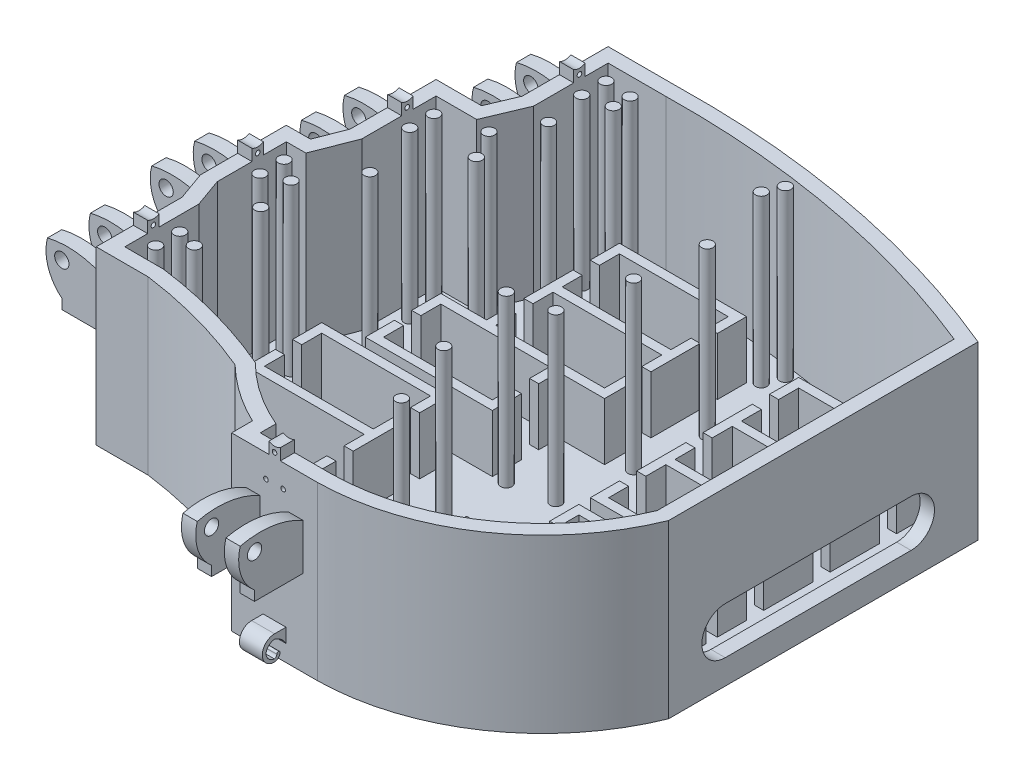
from build123d import *

# Parameters (mm, degrees)
BOSS_EXTRUDE1_DEPTH                = 38.1
CUT_EXTRUDE1_DEPTH                 = 36.83
SERVO_BOX_1_DEPTH                  = 13.97
SERVO_BOX_2_DEPTH                  = 13.97
SERVO_BOX_3_DEPTH                  = 13.97
SERVO_BOX_4_DEPTH                  = 13.97
SERVO_BOX_5_DEPTH                  = 13.97
SERVO_BOX_6_DEPTH                  = 13.97
SERVO_BOX_7_DEPTH                  = 13.97
SERVO_BOX_8_DEPTH                  = 13.97
SERVO_BOX_9_DEPTH                  = 13.97
SERVO_BOX_10_DEPTH                 = 13.97
SKETCH25_R                         = 0.508
THUMB_HOLES_DEPTH                  = 12.7
SKETCH31_R                         = 0.508
INDEX_FINGER_HOLES_DEPTH           = 17.018
SKETCH32_R                         = 0.508
MIDDLE_FINGER_HOLES_DEPTH          = 15.24
SKETCH33_R                         = 0.508
RING_FINGER_HOLES_DEPTH            = 22.86
SKETCH34_R                         = 0.508
PINKY_FINGER_HOLES_DEPTH           = 35.56
SKETCH26_R                         = 1.27
GUIDE_POLES_DEPTH                  = 36.83
SKETCH35_R                         = 1.5875
PINKY_ATTACHMENT_DEPTH             = 19.05
SKETCH36_R                         = 1.5875
RING_ATTACHMENT_DEPTH              = 19.05
SKETCH37_R                         = 1.5875
MIDDLE_ATTACHMENT_DEPTH            = 19.05
SKETCH38_R                         = 1.5875
POINTER_ATTACHMENT_DEPTH           = 19.05
SKETCH39_R                         = 1.5875
THUMB_ATTACHMENT_DEPTH             = 19.05
ATTACHMENT_TRIM_DEPTH              = 25.4
CORD_HOLE_DEPTH                    = 5.08
SKETCH42_W                         = 3.175
SKETCH42_H                         = 2.54
SKETCH42_W_2                       = 2.54
SKETCH42_H_2                       = 3.175
LINE_CONNECTORS_ON_HAND_EDGE_DEPTH = 2.54
SKETCH43_R                         = 0.508
FINGER_LINE_CONNECTOR_CUT_DEPTH    = 50.8
SKETCH44_R                         = 0.508
THUMB_LINE_CONNECTOR_CUT_DEPTH     = 12.7
PINKY_HOOK_DEPTH                   = 19.05
SKETCH47_W                         = 5.527423295
SKETCH47_H                         = 7.099733724
PINKY_HOOK_CUT_1_DEPTH             = 19.05
RING_HOOK_DEPTH                    = 19.05
SKETCH53_W                         = 5.632789883
SKETCH53_H                         = 7.123488913
RING_HOOK_CUT_1_DEPTH              = 19.05
MIDDLE_HOOK_DEPTH                  = 19.05
MIDDLE_HOOK_2_DEPTH                = 19.05
SKETCH57_W                         = 6.44385504
SKETCH57_H                         = 7.30367128
MIDDLE_HOOK_CUT_1_DEPTH            = 19.05
POINTER_HOOK_DEPTH                 = 19.05
SKETCH60_W                         = 5.76253221
SKETCH60_H                         = 6.997945427
POINTER_HOOK_CUT_1_DEPTH           = 19.05
THUMB_HOOK_DEPTH                   = 19.05
SKETCH64_W                         = 5.967890502
SKETCH64_H                         = 7.075125102
THUMB_HOOK_CUT_1_DEPTH             = 19.05
SKETCH65_W                         = 7.179265415
SKETCH65_H                         = 6.121930472
SKETCH65_W_2                       = 6.985
SKETCH65_H_2                       = 5.903479726
SKETCH65_W_3                       = 5.256802475
SKETCH65_H_3                       = 6.985
SKETCH65_W_4                       = 5.256802476
SKETCH65_W_5                       = 5.561170092
CUT_EXTRUDE9_DEPTH                 = 13.97


with BuildPart() as part:
    # Sketch2 → Boss-Extrude1 (new body)
    with BuildSketch(Plane(origin=(0, 0, 0), x_dir=(1, 0, 0), z_dir=(0, 1, 0))):
        with BuildLine():
            Line((-20.778406205, 52.758673202), (-36.188953289, 52.758673202))
            Line((-36.188953289, 52.758673202), (-36.188953289, 33.708673202))
            Line((-36.188953289, 33.708673202), (-38.864171838, 27.358673202))
            Line((-38.864171838, 27.358673202), (-48.947687906, 27.358673202))
            Line((-48.947687906, 27.358673202), (-48.947687906, 8.308673202))
            Line((-48.947687906, 8.308673202), (-51.417120413, 1.958673202))
            Line((-51.417120413, 1.958673202), (-56.767557511, 1.958673202))
            Line((-56.767557511, 1.958673202), (-56.767557511, -17.091326798))
            Line((-56.767557511, -17.091326798), (-54.503911047, -23.441326798))
            Line((-54.503911047, -23.441326798), (-54.503911047, -42.491326798))
            Line((-54.503911047, -42.491326798), (-42.959403849, -42.491326798))
            ThreePointArc((-42.959403849, -42.491326798), (-29.448791922, -45.239401215), (-16.422067996, -49.755263412))
            ThreePointArc((-16.422067996, -49.755263412), (-10.441569813, -54.6928899), (-3.738179712, -58.593027718))
            Line((-3.738179712, -58.593027718), (-3.738179712, -63.210333869))
            Line((-3.738179712, -63.210333869), (15.311820288, -63.210333869))
            ThreePointArc((15.311820288, -63.210333869), (43.202331698, -54.363191859), (61.572422141, -31.588374066))
            Line((61.572422141, -31.588374066), (61.572422141, 37.055318004))
            ThreePointArc((61.572422141, 37.055318004), (21.220515188, 49.225595088), (-20.778406205, 52.758673202))
        make_face()
    extrude(amount=BOSS_EXTRUDE1_DEPTH)

    # Sketch3 → Cut-Extrude1 (cut)
    with BuildSketch(Plane(origin=(0, 38.1, 0), x_dir=(1, 0, 0), z_dir=(0, 1, 0))):
        with BuildLine():
            Line((-20.159319953, 49.594969273), (-33.013953289, 49.594969273))
            Line((-33.013953289, 49.594969273), (-33.013953289, 33.06717139))
            Line((-33.013953289, 33.06717139), (-36.756520081, 24.183673202))
            Line((-36.756520081, 24.183673202), (-45.772687906, 24.183673202))
            Line((-45.772687906, 24.183673202), (-45.772687906, 7.713042295))
            Line((-45.772687906, 7.713042295), (-49.245203545, -1.216326798))
            Line((-49.245203545, -1.216326798), (-53.592557511, -1.216326798))
            Line((-53.592557511, -1.216326798), (-53.592557511, -16.542334896))
            Line((-53.592557511, -16.542334896), (-51.328911047, -22.892334896))
            Line((-51.328911047, -22.892334896), (-51.328911047, -39.316326798))
            Line((-51.328911047, -39.316326798), (-42.747740567, -39.316326798))
            ThreePointArc((-42.747740567, -39.316326798), (-28.419200466, -42.229621341), (-14.622308527, -47.071121038))
            ThreePointArc((-14.622308527, -47.071121038), (-8.048983539, -52.483535855), (-0.563179712, -56.541315619))
            Line((-0.563179712, -56.541315619), (-0.563179712, -60.035333869))
            Line((-0.563179712, -60.035333869), (15.331165443, -60.035333869))
            ThreePointArc((15.331165443, -60.035333869), (41.184823367, -51.896260365), (58.397422141, -30.958672418))
            Line((58.397422141, -30.958672418), (58.397422141, 34.932598454))
            ThreePointArc((58.397422141, 34.932598454), (19.863190978, 46.250670136), (-20.159319953, 49.594969273))
        make_face()
    extrude(amount=-CUT_EXTRUDE1_DEPTH, mode=Mode.SUBTRACT)

    # Sketch6 → Servo Box 1 (add)
    with BuildSketch(Plane(origin=(0, 0, 0), x_dir=(1, 0, 0), z_dir=(0, 1, 0))):
        Polygon((-39.057888343, -32.914501669), (-37.025888343, -32.914501669), (-37.025888343, -37.359501669), (-12.895888343, -37.359501669), (-12.895888343, -32.914501669), (-10.863888343, -32.914501669), (-10.863888343, -39.391501669), (-39.057888343, -39.391501669), align=None)
        Polygon((-12.895888343, -24.659501669), (-37.025888343, -24.659501669), (-37.025888343, -29.104501669), (-39.057888343, -29.104501669), (-39.057888343, -22.627501669), (-10.863888343, -22.627501669), (-10.863888343, -29.104501669), (-12.895888343, -29.104501669), align=None)
    extrude(amount=SERVO_BOX_1_DEPTH)

    # Sketch7 → Servo Box 2 (add)
    with BuildSketch(Plane(origin=(0, 0, 0), x_dir=(1, 0, 0), z_dir=(0, 1, 0))):
        Polygon((-39.057888343, -18.182501669), (-37.025888343, -18.182501669), (-37.025888343, -22.627501669), (-12.895888343, -22.627501669), (-12.895888343, -18.182501669), (-10.863888343, -18.182501669), (-10.863888343, -24.659501669), (-39.057888343, -24.659501669), align=None)
        Polygon((-12.895888343, -9.927501669), (-37.025888343, -9.927501669), (-37.025888343, -14.372501669), (-39.057888343, -14.372501669), (-39.057888343, -7.895501669), (-10.863888343, -7.895501669), (-10.863888343, -14.372501669), (-12.895888343, -14.372501669), align=None)
    extrude(amount=SERVO_BOX_2_DEPTH)

    # Sketch15 → Servo Box 3 (add)
    with BuildSketch(Plane.XZ):
        Polygon((-31.437888343, -4.423498331), (-29.405888343, -4.423498331), (-29.405888343, -8.868498331), (-5.275888343, -8.868498331), (-5.275888343, -4.423498331), (-3.243888343, -4.423498331), (-3.243888343, -10.900498331), (-31.437888343, -10.900498331), align=None)
        Polygon((-5.275888343, 3.831501669), (-29.405888343, 3.831501669), (-29.405888343, -0.613498331), (-31.437888343, -0.613498331), (-31.437888343, 5.863501669), (-3.243888343, 5.863501669), (-3.243888343, -0.613498331), (-5.275888343, -0.613498331), align=None)
    extrude(amount=-SERVO_BOX_3_DEPTH)

    # Sketch16 → Servo Box 4 (add)
    with BuildSketch(Plane.XZ):
        Polygon((-21.277888343, -19.155498331), (-19.245888343, -19.155498331), (-19.245888343, -23.600498331), (4.884111657, -23.600498331), (4.884111657, -19.155498331), (6.916111657, -19.155498331), (6.916111657, -25.632498331), (-21.277888343, -25.632498331), align=None)
        Polygon((4.884111657, -10.900498331), (-19.245888343, -10.900498331), (-19.245888343, -15.345498331), (-21.277888343, -15.345498331), (-21.277888343, -8.868498331), (6.916111657, -8.868498331), (6.916111657, -15.345498331), (4.884111657, -15.345498331), align=None)
    extrude(amount=-SERVO_BOX_4_DEPTH)

    # Sketch17 → Servo Box 5 (add)
    with BuildSketch(Plane.XZ):
        Polygon((-21.277888343, -33.887498331), (-19.245888343, -33.887498331), (-19.245888343, -38.332498331), (4.884111657, -38.332498331), (4.884111657, -33.887498331), (6.916111657, -33.887498331), (6.916111657, -40.364498331), (-21.277888343, -40.364498331), align=None)
        Polygon((4.884111657, -25.632498331), (-19.245888343, -25.632498331), (-19.245888343, -30.077498331), (-21.277888343, -30.077498331), (-21.277888343, -23.600498331), (6.916111657, -23.600498331), (6.916111657, -30.077498331), (4.884111657, -30.077498331), align=None)
    extrude(amount=-SERVO_BOX_5_DEPTH)

    # Sketch18 → Servo Box 6 (add)
    with BuildSketch(Plane.XZ):
        Polygon((14.218982224, 35.510467966), (16.250982224, 35.510467966), (16.250982224, 31.065467966), (40.380982224, 31.065467966), (40.380982224, 35.510467966), (42.412982224, 35.510467966), (42.412982224, 29.033467966), (14.218982224, 29.033467966), align=None)
        Polygon((40.380982224, 43.765467966), (16.250982224, 43.765467966), (16.250982224, 39.320467966), (14.218982224, 39.320467966), (14.218982224, 45.797467966), (42.412982224, 45.797467966), (42.412982224, 39.320467966), (40.380982224, 39.320467966), align=None)
    extrude(amount=-SERVO_BOX_6_DEPTH)

    # Sketch19 → Servo Box 7 (add)
    with BuildSketch(Plane.XZ):
        Polygon((24.378982224, 20.778467966), (26.410982224, 20.778467966), (26.410982224, 16.333467966), (50.540982224, 16.333467966), (50.540982224, 20.778467966), (52.572982224, 20.778467966), (52.572982224, 14.301467966), (24.378982224, 14.301467966), align=None)
        Polygon((50.540982224, 29.033467966), (26.410982224, 29.033467966), (26.410982224, 24.588467966), (24.378982224, 24.588467966), (24.378982224, 31.065467966), (52.572982224, 31.065467966), (52.572982224, 24.588467966), (50.540982224, 24.588467966), align=None)
    extrude(amount=-SERVO_BOX_7_DEPTH)

    # Sketch20 → Servo Box 8 (add)
    with BuildSketch(Plane.XZ):
        Polygon((24.378982224, 1.474467966), (26.410982224, 1.474467966), (26.410982224, -2.970532034), (50.540982224, -2.970532034), (50.540982224, 1.474467966), (52.572982224, 1.474467966), (52.572982224, -5.002532034), (24.378982224, -5.002532034), align=None)
        Polygon((50.540982224, 9.729467966), (26.410982224, 9.729467966), (26.410982224, 5.284467966), (24.378982224, 5.284467966), (24.378982224, 11.761467966), (52.572982224, 11.761467966), (52.572982224, 5.284467966), (50.540982224, 5.284467966), align=None)
    extrude(amount=-SERVO_BOX_8_DEPTH)

    # Sketch21 → Servo Box 9 (add)
    with BuildSketch(Plane.XZ):
        Polygon((24.378982224, -13.257532034), (26.410982224, -13.257532034), (26.410982224, -17.702532034), (50.540982224, -17.702532034), (50.540982224, -13.257532034), (52.572982224, -13.257532034), (52.572982224, -19.734532034), (24.378982224, -19.734532034), align=None)
        Polygon((50.540982224, -5.002532034), (26.410982224, -5.002532034), (26.410982224, -9.447532034), (24.378982224, -9.447532034), (24.378982224, -2.970532034), (52.572982224, -2.970532034), (52.572982224, -9.447532034), (50.540982224, -9.447532034), align=None)
    extrude(amount=-SERVO_BOX_9_DEPTH)

    # Sketch22 → Servo Box 10 (add)
    with BuildSketch(Plane.XZ):
        Polygon((24.378982224, -27.989532034), (26.410982224, -27.989532034), (26.410982224, -32.434532034), (50.540982224, -32.434532034), (50.540982224, -27.989532034), (52.572982224, -27.989532034), (52.572982224, -34.466532034), (24.378982224, -34.466532034), align=None)
        Polygon((50.540982224, -19.734532034), (26.410982224, -19.734532034), (26.410982224, -24.179532034), (24.378982224, -24.179532034), (24.378982224, -17.702532034), (52.572982224, -17.702532034), (52.572982224, -24.179532034), (50.540982224, -24.179532034), align=None)
    extrude(amount=-SERVO_BOX_10_DEPTH)

    # Sketch25 → Thumb Holes (cut)
    with BuildSketch(Plane.XY.offset(63.5)):
        with Locations((7.691820288, 33.02)):
            Circle(SKETCH25_R)
        with Locations((3.881820288, 33.02)):
            Circle(SKETCH25_R)
    extrude(amount=-THUMB_HOLES_DEPTH, mode=Mode.SUBTRACT)

    # Sketch31 → Index Finger Holes (cut)
    with BuildSketch(Plane(origin=(-69.85, 0, 0), x_dir=(0, 0, -1), z_dir=(1, 0, 0))):
        with Locations((-31.061326798, 33.02)):
            Circle(SKETCH31_R)
        with Locations((-34.871326798, 33.02)):
            Circle(SKETCH31_R)
    extrude(amount=INDEX_FINGER_HOLES_DEPTH, mode=Mode.SUBTRACT)

    # Sketch32 → Middle Finger Holes (cut)
    with BuildSketch(Plane(origin=(-69.85, 0, 0), x_dir=(0, 0, -1), z_dir=(1, 0, 0))):
        with Locations((-9.471326798, 33.02)):
            Circle(SKETCH32_R)
        with Locations((-5.661326798, 33.02)):
            Circle(SKETCH32_R)
    extrude(amount=MIDDLE_FINGER_HOLES_DEPTH, mode=Mode.SUBTRACT)

    # Sketch33 → Ring Finger Holes (cut)
    with BuildSketch(Plane(origin=(-69.85, 0, 0), x_dir=(0, 0, -1), z_dir=(1, 0, 0))):
        with Locations((15.928673202, 33.02)):
            Circle(SKETCH33_R)
        with Locations((19.738673202, 33.02)):
            Circle(SKETCH33_R)
    extrude(amount=RING_FINGER_HOLES_DEPTH, mode=Mode.SUBTRACT)

    # Sketch34 → Pinky Finger Holes (cut)
    with BuildSketch(Plane(origin=(-69.85, 0, 0), x_dir=(0, 0, -1), z_dir=(1, 0, 0))):
        with Locations((41.328673202, 33.02)):
            Circle(SKETCH34_R)
        with Locations((45.181435651, 33.02)):
            Circle(SKETCH34_R)
    extrude(amount=PINKY_FINGER_HOLES_DEPTH, mode=Mode.SUBTRACT)

    # Sketch26 → Guide Poles (add)
    with BuildSketch(Plane(origin=(0, 38.1, 0), x_dir=(1, 0, 0), z_dir=(0, 1, 0))):
        with Locations((8.453820288, -37.732967966)):
            Circle(SKETCH26_R)
        with Locations((3.119820288, -23.000967966)):
            Circle(SKETCH26_R)
        with Locations((8.678446045, -3.696967966)):
            Circle(SKETCH26_R)
        with Locations((11.201223007, 11.035032034)):
            Circle(SKETCH26_R)
        with Locations((12.805413161, 25.767032034)):
            Circle(SKETCH26_R)
        with Locations((-0.402046797, -5.607456419)):
            Circle(SKETCH26_R)
        with Locations((10.265413161, 45.617861539)):
            Circle(SKETCH26_R)
        with Locations((8.661223007, 41.885747394)):
            Circle(SKETCH26_R)
        with Locations((-45.613911047, -8.147456419)):
            Circle(SKETCH26_R)
        with Locations((-50.417557511, -10.233326798)):
            Circle(SKETCH26_R)
        with Locations((-50.417557511, -4.899326798)):
            Circle(SKETCH26_R)
        with Locations((-43.893096038, -16.595001669)):
            Circle(SKETCH26_R)
        with Locations((-38.480256327, 2.200998331)):
            Circle(SKETCH26_R)
        with Locations((-29.603786365, 16.932998331)):
            Circle(SKETCH26_R)
        with Locations((-42.597687906, 15.166673202)):
            Circle(SKETCH26_R)
        with Locations((-28.301638115, 31.664998331)):
            Circle(SKETCH26_R)
        with Locations((-33.046983998, 23.19417141)):
            Circle(SKETCH26_R)
        with Locations((-42.597687906, 20.500673202)):
            Circle(SKETCH26_R)
        with Locations((-24.169255621, 41.885747394)):
            Circle(SKETCH26_R)
        with Locations((-24.169255621, 45.617861539)):
            Circle(SKETCH26_R)
        with Locations((-29.838953289, 40.566673202)):
            Circle(SKETCH26_R)
        with Locations((-29.838953289, 45.943435651)):
            Circle(SKETCH26_R)
        with Locations((-48.153911047, -35.633326798)):
            Circle(SKETCH26_R)
        with Locations((-48.153911047, -30.299326798)):
            Circle(SKETCH26_R)
        with Locations((-43.893096038, -31.327001669)):
            Circle(SKETCH26_R)
    extrude(amount=-GUIDE_POLES_DEPTH)

    # Sketch35 → Pinky Attachment (add)
    with BuildSketch(Plane(origin=(0, 0, -52.758673202), x_dir=(-1, 0, 0), z_dir=(0, 0, -1))):
        with BuildLine():
            Line((36.188953289, 19.05), (40.633953289, 19.05))
            Line((40.633953289, 19.05), (46.983953289, 19.05))
            Line((46.983953289, 19.05), (46.983953289, 21.249207691))
            ThreePointArc((46.983953289, 21.249207691), (50.046648442, 25.776891551), (50.158953289, 31.242))
            ThreePointArc((50.158953289, 31.242), (42.978780551, 31.567812574), (36.188953289, 29.21))
            Line((36.188953289, 29.21), (36.188953289, 19.05))
        make_face()
        with Locations((46.983953289, 28.575)):
            Circle(SKETCH35_R, mode=Mode.SUBTRACT)
    extrude(amount=-PINKY_ATTACHMENT_DEPTH)

    # Sketch36 → Ring Attachment (add)
    with BuildSketch(Plane(origin=(0, 0, -27.358673202), x_dir=(-1, 0, 0), z_dir=(0, 0, -1))):
        with BuildLine():
            Line((48.947687906, 29.21), (48.947687906, 19.05))
            Line((48.947687906, 19.05), (53.392687906, 19.05))
            Line((53.392687906, 19.05), (59.742687906, 19.05))
            Line((59.742687906, 19.05), (59.742687906, 21.249207691))
            ThreePointArc((59.742687906, 21.249207691), (62.80538306, 25.776891551), (62.917687906, 31.242))
            ThreePointArc((62.917687906, 31.242), (55.737515168, 31.567812574), (48.947687906, 29.21))
        make_face()
        with Locations((59.742687906, 28.707395517)):
            Circle(SKETCH36_R, mode=Mode.SUBTRACT)
    extrude(amount=-RING_ATTACHMENT_DEPTH)

    # Sketch37 → Middle Attachment (add)
    with BuildSketch(Plane(origin=(0, 0, -1.958673202), x_dir=(-1, 0, 0), z_dir=(0, 0, -1))):
        with BuildLine():
            Line((56.767557511, 29.21), (56.767557511, 19.05))
            Line((56.767557511, 19.05), (61.212557511, 19.05))
            Line((61.212557511, 19.05), (67.562557511, 19.05))
            Line((67.562557511, 19.05), (67.562557511, 21.249207691))
            ThreePointArc((67.562557511, 21.249207691), (70.625252665, 25.776891551), (70.737557511, 31.242))
            ThreePointArc((70.737557511, 31.242), (63.557384773, 31.567812574), (56.767557511, 29.21))
        make_face()
        with Locations((67.562557511, 28.575)):
            Circle(SKETCH37_R, mode=Mode.SUBTRACT)
    extrude(amount=-MIDDLE_ATTACHMENT_DEPTH)

    # Sketch38 → Pointer Attachment (add)
    with BuildSketch(Plane(origin=(0, 0, 23.441326798), x_dir=(-1, 0, 0), z_dir=(0, 0, -1))):
        with BuildLine():
            Line((54.503911047, 29.21), (54.503911047, 19.05))
            Line((54.503911047, 19.05), (65.298911047, 19.05))
            Line((65.298911047, 19.05), (65.298911047, 21.249207691))
            ThreePointArc((65.298911047, 21.249207691), (68.3616062, 25.776891551), (68.473911047, 31.242))
            ThreePointArc((68.473911047, 31.242), (61.293738309, 31.567812574), (54.503911047, 29.21))
        make_face()
        with Locations((65.298911047, 28.575)):
            Circle(SKETCH38_R, mode=Mode.SUBTRACT)
    extrude(amount=-POINTER_ATTACHMENT_DEPTH)

    # Sketch39 → Thumb Attachment (add)
    with BuildSketch(Plane.ZY.offset(3.738179712)):
        with BuildLine():
            Line((63.210333869, 19.05), (67.655333869, 19.05))
            Line((67.655333869, 19.05), (74.005333869, 19.05))
            Line((74.005333869, 19.05), (74.005333869, 21.249207691))
            ThreePointArc((74.005333869, 21.249207691), (77.068029022, 25.776891551), (77.180333869, 31.242))
            ThreePointArc((77.180333869, 31.242), (70.000161131, 31.567812574), (63.210333869, 29.21))
            Line((63.210333869, 29.21), (63.210333869, 19.05))
        make_face()
        with Locations((74.005333869, 28.575)):
            Circle(SKETCH39_R, mode=Mode.SUBTRACT)
    extrude(amount=-THUMB_ATTACHMENT_DEPTH)

    # Sketch40 → Attachment Trim (cut)
    with BuildSketch(Plane(origin=(0, 38.1, 0), x_dir=(1, 0, 0), z_dir=(0, 1, 0))):
        with BuildLine():
            Line((2.611820288, -63.210333869), (8.961820288, -63.210333869))
            Line((8.961820288, -63.210333869), (8.961820288, -80.196396356))
            Line((8.961820288, -80.196396356), (12.136820288, -80.196396356))
            Line((12.136820288, -80.196396356), (12.136820288, -63.210333869))
            Line((12.136820288, -63.210333869), (15.311820288, -63.210333869))
            ThreePointArc((15.311820288, -63.210333869), (4.445704746, -85.500344062), (-6.420410797, -63.210333869))
            Line((-6.420410797, -63.210333869), (-0.563179712, -63.210333869))
            Line((-0.563179712, -63.210333869), (-0.563179712, -80.139154797))
            Line((-0.563179712, -80.139154797), (2.611820288, -80.139154797))
            Line((2.611820288, -80.139154797), (2.611820288, -63.210333869))
        make_face()
        with BuildLine():
            Line((-54.503911047, -42.491326798), (-54.503911047, -39.316326798))
            Line((-54.503911047, -39.316326798), (-69.450746427, -39.316326798))
            Line((-69.450746427, -39.316326798), (-69.450746427, -36.141326798))
            Line((-69.450746427, -36.141326798), (-54.503911047, -36.141326798))
            Line((-54.503911047, -36.141326798), (-54.503911047, -29.791326798))
            Line((-54.503911047, -29.791326798), (-69.522821924, -29.791326798))
            Line((-69.522821924, -29.791326798), (-69.522821924, -26.616326798))
            Line((-69.522821924, -26.616326798), (-54.503911047, -26.616326798))
            Line((-54.503911047, -26.616326798), (-54.503911047, -23.441326798))
            ThreePointArc((-54.503911047, -23.441326798), (-74.827366982, -32.966326798), (-54.503911047, -42.491326798))
        make_face()
        with BuildLine():
            Line((-56.767557511, -17.091326798), (-56.767557511, -13.916326798))
            Line((-56.767557511, -13.916326798), (-71.425044096, -13.916326798))
            Line((-71.425044096, -13.916326798), (-71.425044096, -10.741326798))
            Line((-71.425044096, -10.741326798), (-56.767557511, -10.741326798))
            Line((-56.767557511, -10.741326798), (-56.767557511, -4.391326798))
            Line((-56.767557511, -4.391326798), (-71.300395146, -4.391326798))
            Line((-71.300395146, -4.391326798), (-71.300395146, -1.216326798))
            Line((-71.300395146, -1.216326798), (-56.767557511, -1.216326798))
            Line((-56.767557511, -1.216326798), (-56.767557511, 1.958673202))
            ThreePointArc((-56.767557511, 1.958673202), (-78.393851178, -7.566326798), (-56.767557511, -17.091326798))
        make_face()
        with BuildLine():
            Line((-48.947687906, 8.308673202), (-48.947687906, 11.483673202))
            Line((-48.947687906, 11.483673202), (-65.361733155, 11.483673202))
            Line((-65.361733155, 11.483673202), (-65.361733155, 14.658673202))
            Line((-65.361733155, 14.658673202), (-48.947687906, 14.658673202))
            Line((-48.947687906, 14.658673202), (-48.947687906, 21.008673202))
            Line((-48.947687906, 21.008673202), (-65.776264763, 21.008673202))
            Line((-65.776264763, 21.008673202), (-65.776264763, 24.183673202))
            Line((-65.776264763, 24.183673202), (-48.947687906, 24.183673202))
            Line((-48.947687906, 24.183673202), (-48.947687906, 27.358673202))
            ThreePointArc((-48.947687906, 27.358673202), (-69.447688873, 17.833673202), (-48.947687906, 8.308673202))
        make_face()
        with BuildLine():
            Line((-36.188953289, 33.708673202), (-36.188953289, 36.883673202))
            Line((-36.188953289, 36.883673202), (-51.878710413, 36.883673202))
            Line((-51.878710413, 36.883673202), (-51.878710413, 40.058673202))
            Line((-51.878710413, 40.058673202), (-36.188953289, 40.058673202))
            Line((-36.188953289, 40.058673202), (-36.188953289, 46.408673202))
            Line((-36.188953289, 46.408673202), (-51.739164497, 46.408673202))
            Line((-51.739164497, 46.408673202), (-51.739164497, 49.583673202))
            Line((-51.739164497, 49.583673202), (-36.188953289, 49.583673202))
            Line((-36.188953289, 49.583673202), (-36.188953289, 52.758673202))
            ThreePointArc((-36.188953289, 52.758673202), (-55.79651108, 43.233673202), (-36.188953289, 33.708673202))
        make_face()
    extrude(amount=-ATTACHMENT_TRIM_DEPTH, mode=Mode.SUBTRACT)

    # Sketch41 → Cord Hole (cut)
    with BuildSketch(Plane(origin=(62.913848002, 0, 0), x_dir=(0, 0, -1), z_dir=(1, 0, 0))):
        with BuildLine():
            Line((-19.01291879, 15.851932983), (22.200875308, 15.851932983))
            ThreePointArc((22.200875308, 15.851932983), (27.393164329, 10.659643963), (22.200875308, 5.467354942))
            Line((22.200875308, 5.467354942), (-19.01291879, 5.467354942))
            ThreePointArc((-19.01291879, 5.467354942), (-24.20520781, 10.659643963), (-19.01291879, 15.851932983))
        make_face()
    extrude(amount=-CORD_HOLE_DEPTH, mode=Mode.SUBTRACT)

    # Sketch42 → Line Connectors on Hand Edge (add)
    with BuildSketch(Plane(origin=(0, 38.1, 0), x_dir=(1, 0, 0), z_dir=(0, 1, 0))):
        with Locations((-34.601453289, 43.233673202)):
            Rectangle(SKETCH42_W, SKETCH42_H)
        with Locations((-47.360187906, 17.833673202)):
            Rectangle(SKETCH42_W, SKETCH42_H)
        with Locations((-55.180057511, -7.566326798)):
            Rectangle(SKETCH42_W, SKETCH42_H)
        with Locations((-52.916411047, -32.966326798)):
            Rectangle(SKETCH42_W, SKETCH42_H)
        with Locations((5.786820288, -61.622833869)):
            Rectangle(SKETCH42_W_2, SKETCH42_H_2)
    extrude(amount=LINE_CONNECTORS_ON_HAND_EDGE_DEPTH)

    # Sketch43 → Finger Line Connector Cut (cut)
    with BuildSketch(Plane(origin=(-69.85, 0, 0), x_dir=(0, 0, -1), z_dir=(1, 0, 0))):
        with Locations((-32.966326798, 39.116)):
            Circle(SKETCH43_R)
        with Locations((-7.566326798, 39.116)):
            Circle(SKETCH43_R)
        with Locations((17.770173202, 39.116)):
            Circle(SKETCH43_R)
        with Locations((43.233673202, 39.116)):
            Circle(SKETCH43_R)
        with BuildLine():
            ThreePointArc((-34.236326798, 40.64), (-32.966326798, 40.299704526), (-31.696326798, 40.64))
            ThreePointArc((-31.696326798, 40.64), (-32.966326798, 40.834853661), (-34.236326798, 40.64))
        make_face()
        with BuildLine():
            ThreePointArc((-8.836326798, 40.64), (-7.566326798, 40.299704526), (-6.296326798, 40.64))
            ThreePointArc((-6.296326798, 40.64), (-7.566326798, 50.63868885), (-8.836326798, 40.64))
        make_face()
        with BuildLine():
            ThreePointArc((16.563673202, 40.64), (17.833673202, 40.299704526), (19.103673202, 40.64))
            ThreePointArc((19.103673202, 40.64), (17.833673202, 41.988898773), (16.563673202, 40.64))
        make_face()
        with BuildLine():
            ThreePointArc((41.963673202, 40.64), (43.233673202, 40.299704526), (44.503673202, 40.64))
            ThreePointArc((44.503673202, 40.64), (43.233673202, 40.80131115), (41.963673202, 40.64))
        make_face()
    extrude(amount=FINGER_LINE_CONNECTOR_CUT_DEPTH, mode=Mode.SUBTRACT)

    # Sketch44 → Thumb Line Connector Cut (cut)
    with BuildSketch(Plane.XY.offset(63.5)):
        with Locations((5.786820288, 39.116)):
            Circle(SKETCH44_R)
        with BuildLine():
            ThreePointArc((7.056820288, 40.64), (5.786820288, 40.299704526), (4.516820288, 40.64))
            ThreePointArc((4.516820288, 40.64), (5.786820288, 45.379704526), (7.056820288, 40.64))
        make_face()
    extrude(amount=-THUMB_LINE_CONNECTOR_CUT_DEPTH, mode=Mode.SUBTRACT)

    # Sketch46 → Pinky Hook (add)
    with BuildSketch(Plane(origin=(0, 0, -52.758673202), x_dir=(-1, 0, 0), z_dir=(0, 0, -1))):
        with BuildLine():
            Line((38.728953289, 8.89), (36.188953289, 8.89))
            Line((36.188953289, 8.89), (36.188953289, 12.007013633))
            ThreePointArc((36.188953289, 12.007013633), (37.253888001, 10.713868099), (38.728953289, 9.919831756))
            ThreePointArc((38.728953289, 9.919831756), (40.011077208, 10.520271405), (40.650106055, 11.783604952))
            ThreePointArc((40.650106055, 11.783604952), (40.045282722, 13.07409489), (38.764186085, 13.69856823))
            ThreePointArc((38.764186085, 13.69856823), (38.378904743, 13.481176717), (38.223605208, 13.066951131))
            ThreePointArc((38.223605208, 13.066951131), (37.883185134, 12.706641867), (37.522875871, 13.047061941))
            ThreePointArc((37.522875871, 13.047061941), (37.861533866, 13.935120258), (38.728953289, 14.323604952))
            ThreePointArc((38.728953289, 14.323604952), (40.650022742, 13.52787193), (41.445755764, 11.606802476))
            ThreePointArc((41.445755764, 11.606802476), (40.650022742, 9.685733022), (38.728953289, 8.89))
        make_face()
        with BuildLine():
            Line((38.728953289, 6.798773562), (36.188953289, 6.798773562))
            Line((36.188953289, 6.798773562), (36.188953289, 3.681759929))
            ThreePointArc((36.188953289, 3.681759929), (37.253888001, 4.974905464), (38.728953289, 5.768941806))
            ThreePointArc((38.728953289, 5.768941806), (40.011077208, 5.168502157), (40.650106055, 3.905168611))
            ThreePointArc((40.650106055, 3.905168611), (40.045282722, 2.614678673), (38.764186085, 1.990205333))
            ThreePointArc((38.764186085, 1.990205333), (38.378904743, 2.207596845), (38.223605208, 2.621822432))
            ThreePointArc((38.223605208, 2.621822432), (37.883185134, 2.982131695), (37.522875871, 2.641711621))
            ThreePointArc((37.522875871, 2.641711621), (37.861533866, 1.753653304), (38.728953289, 1.365168611))
            ThreePointArc((38.728953289, 1.365168611), (40.650022742, 2.160901633), (41.445755764, 4.081971086))
            ThreePointArc((41.445755764, 4.081971086), (40.650022742, 6.00304054), (38.728953289, 6.798773562))
        make_face()
    extrude(amount=-PINKY_HOOK_DEPTH)

    # Sketch47 → Pinky Hook Cut 1 (cut)
    with BuildSketch(Plane(origin=(0, 0, -52.758673202), x_dir=(-1, 0, 0), z_dir=(0, 0, -1))):
        with Locations((38.952664936, 12.322077186)):
            Rectangle(SKETCH47_W, SKETCH47_H)
    extrude(amount=-PINKY_HOOK_CUT_1_DEPTH, mode=Mode.SUBTRACT)

    # Sketch52 → Ring Hook (add)
    with BuildSketch(Plane(origin=(0, 0, -27.358673202), x_dir=(-1, 0, 0), z_dir=(0, 0, -1))):
        with BuildLine():
            Line((51.487687906, 8.89), (48.947687906, 8.89))
            Line((48.947687906, 8.89), (48.947687906, 12.007013633))
            ThreePointArc((48.947687906, 12.007013633), (50.012622619, 10.713868099), (51.487687906, 9.919831756))
            ThreePointArc((51.487687906, 9.919831756), (52.769811826, 10.520271405), (53.408840673, 11.783604952))
            ThreePointArc((53.408840673, 11.783604952), (52.80401734, 13.07409489), (51.522920703, 13.69856823))
            ThreePointArc((51.522920703, 13.69856823), (51.13763936, 13.481176717), (50.982339826, 13.066951131))
            ThreePointArc((50.982339826, 13.066951131), (50.641919752, 12.706641867), (50.281610489, 13.047061941))
            ThreePointArc((50.281610489, 13.047061941), (50.620268484, 13.935120258), (51.487687906, 14.323604952))
            ThreePointArc((51.487687906, 14.323604952), (53.40875736, 13.52787193), (54.204490382, 11.606802476))
            ThreePointArc((54.204490382, 11.606802476), (53.40875736, 9.685733022), (51.487687906, 8.89))
        make_face()
        with BuildLine():
            Line((51.487687906, 6.798773562), (48.947687906, 6.798773562))
            Line((48.947687906, 6.798773562), (48.947687906, 3.681759929))
            ThreePointArc((48.947687906, 3.681759929), (50.012622619, 4.974905464), (51.487687906, 5.768941806))
            ThreePointArc((51.487687906, 5.768941806), (52.769811826, 5.168502157), (53.408840673, 3.905168611))
            ThreePointArc((53.408840673, 3.905168611), (52.80401734, 2.614678673), (51.522920703, 1.990205333))
            ThreePointArc((51.522920703, 1.990205333), (51.13763936, 2.207596845), (50.982339826, 2.621822432))
            ThreePointArc((50.982339826, 2.621822432), (50.641919752, 2.982131695), (50.281610489, 2.641711621))
            ThreePointArc((50.281610489, 2.641711621), (50.620268484, 1.753653304), (51.487687906, 1.365168611))
            ThreePointArc((51.487687906, 1.365168611), (53.40875736, 2.160901633), (54.204490382, 4.081971086))
            ThreePointArc((54.204490382, 4.081971086), (53.40875736, 6.00304054), (51.487687906, 6.798773562))
        make_face()
    extrude(amount=-RING_HOOK_DEPTH)

    # Sketch53 → Ring Hook Cut 1 (cut)
    with BuildSketch(Plane(origin=(0, 0, -27.358673202), x_dir=(-1, 0, 0), z_dir=(0, 0, -1))):
        with Locations((51.764082848, 11.948421999)):
            Rectangle(SKETCH53_W, SKETCH53_H)
    extrude(amount=-RING_HOOK_CUT_1_DEPTH, mode=Mode.SUBTRACT)

    # Sketch59 → Pointer Hook (add)
    with BuildSketch(Plane(origin=(0, 0, 23.441326798), x_dir=(-1, 0, 0), z_dir=(0, 0, -1))):
        with BuildLine():
            Line((57.043911047, 8.89), (54.503911047, 8.89))
            Line((54.503911047, 8.89), (54.503911047, 12.007013633))
            ThreePointArc((54.503911047, 12.007013633), (55.568845759, 10.713868099), (57.043911047, 9.919831756))
            ThreePointArc((57.043911047, 9.919831756), (58.326034966, 10.520271405), (58.965063813, 11.783604952))
            ThreePointArc((58.965063813, 11.783604952), (58.36024048, 13.07409489), (57.079143843, 13.69856823))
            ThreePointArc((57.079143843, 13.69856823), (56.693862501, 13.481176717), (56.538562966, 13.066951131))
            ThreePointArc((56.538562966, 13.066951131), (56.198142892, 12.706641867), (55.837833629, 13.047061941))
            ThreePointArc((55.837833629, 13.047061941), (56.176491624, 13.935120258), (57.043911047, 14.323604952))
            ThreePointArc((57.043911047, 14.323604952), (58.9649805, 13.52787193), (59.760713522, 11.606802476))
            ThreePointArc((59.760713522, 11.606802476), (58.9649805, 9.685733022), (57.043911047, 8.89))
        make_face()
        with BuildLine():
            Line((57.043911047, 6.798773562), (54.503911047, 6.798773562))
            Line((54.503911047, 6.798773562), (54.503911047, 3.681759929))
            ThreePointArc((54.503911047, 3.681759929), (55.568845759, 4.974905464), (57.043911047, 5.768941806))
            ThreePointArc((57.043911047, 5.768941806), (58.326034966, 5.168502157), (58.965063813, 3.905168611))
            ThreePointArc((58.965063813, 3.905168611), (58.36024048, 2.614678673), (57.079143843, 1.990205333))
            ThreePointArc((57.079143843, 1.990205333), (56.693862501, 2.207596845), (56.538562966, 2.621822432))
            ThreePointArc((56.538562966, 2.621822432), (56.198142892, 2.982131695), (55.837833629, 2.641711621))
            ThreePointArc((55.837833629, 2.641711621), (56.176491624, 1.753653304), (57.043911047, 1.365168611))
            ThreePointArc((57.043911047, 1.365168611), (58.9649805, 2.160901633), (59.760713522, 4.081971086))
            ThreePointArc((59.760713522, 4.081971086), (58.9649805, 6.00304054), (57.043911047, 6.798773562))
        make_face()
    extrude(amount=-POINTER_HOOK_DEPTH)

    # Sketch60 → Pointer Hook Cut 1 (cut)
    with BuildSketch(Plane(origin=(0, 0, 23.441326798), x_dir=(-1, 0, 0), z_dir=(0, 0, -1))):
        with Locations((57.385177152, 11.759931593)):
            Rectangle(SKETCH60_W, SKETCH60_H)
    extrude(amount=-POINTER_HOOK_CUT_1_DEPTH, mode=Mode.SUBTRACT)

    # Sketch63 → Thumb Hook (add)
    with BuildSketch(Plane.ZY.offset(3.738179712)):
        with BuildLine():
            Line((65.750333869, 8.89), (63.210333869, 8.89))
            Line((63.210333869, 8.89), (63.210333869, 12.007013633))
            ThreePointArc((63.210333869, 12.007013633), (64.275268581, 10.713868099), (65.750333869, 9.919831756))
            ThreePointArc((65.750333869, 9.919831756), (67.032457789, 10.520271405), (67.671486635, 11.783604952))
            ThreePointArc((67.671486635, 11.783604952), (67.066663302, 13.07409489), (65.785566665, 13.69856823))
            ThreePointArc((65.785566665, 13.69856823), (65.400285323, 13.481176717), (65.244985788, 13.066951131))
            ThreePointArc((65.244985788, 13.066951131), (64.904565714, 12.706641867), (64.544256451, 13.047061941))
            ThreePointArc((64.544256451, 13.047061941), (64.882914446, 13.935120258), (65.750333869, 14.323604952))
            ThreePointArc((65.750333869, 14.323604952), (67.671403323, 13.52787193), (68.467136345, 11.606802476))
            ThreePointArc((68.467136345, 11.606802476), (67.671403323, 9.685733022), (65.750333869, 8.89))
        make_face()
        with BuildLine():
            Line((65.750333869, 6.798773562), (63.210333869, 6.798773562))
            Line((63.210333869, 6.798773562), (63.210333869, 3.681759929))
            ThreePointArc((63.210333869, 3.681759929), (64.275268581, 4.974905464), (65.750333869, 5.768941806))
            ThreePointArc((65.750333869, 5.768941806), (67.032457789, 5.168502157), (67.671486635, 3.905168611))
            ThreePointArc((67.671486635, 3.905168611), (67.066663302, 2.614678673), (65.785566665, 1.990205333))
            ThreePointArc((65.785566665, 1.990205333), (65.400285323, 2.207596845), (65.244985788, 2.621822432))
            ThreePointArc((65.244985788, 2.621822432), (64.904565714, 2.982131695), (64.544256451, 2.641711621))
            ThreePointArc((64.544256451, 2.641711621), (64.882914446, 1.753653304), (65.750333869, 1.365168611))
            ThreePointArc((65.750333869, 1.365168611), (67.671403323, 2.160901633), (68.467136345, 4.081971086))
            ThreePointArc((68.467136345, 4.081971086), (67.671403323, 6.00304054), (65.750333869, 6.798773562))
        make_face()
    extrude(amount=-THUMB_HOOK_DEPTH)

    # Sketch64 → Thumb Hook Cut 1 (cut)
    with BuildSketch(Plane.ZY.offset(3.738179712)):
        with Locations((66.19427912, 11.933173705)):
            Rectangle(SKETCH64_W, SKETCH64_H)
    extrude(amount=-THUMB_HOOK_CUT_1_DEPTH, mode=Mode.SUBTRACT)


with BuildPart() as body_2:
    # Sketch56 → Middle Hook (new body)
    with BuildSketch(Plane(origin=(0, 0, -1.958673202), x_dir=(-1, 0, 0), z_dir=(0, 0, -1))):
        with BuildLine():
            Line((59.307557511, 8.89), (56.767557511, 8.89))
            Line((56.767557511, 8.89), (56.767557511, 12.007013633))
            ThreePointArc((56.767557511, 12.007013633), (57.832492224, 10.713868099), (59.307557511, 9.919831756))
            ThreePointArc((59.307557511, 9.919831756), (60.589681431, 10.520271405), (61.228710278, 11.783604952))
            ThreePointArc((61.228710278, 11.783604952), (60.623886944, 13.07409489), (59.342790307, 13.69856823))
            ThreePointArc((59.342790307, 13.69856823), (58.957508965, 13.481176717), (58.80220943, 13.066951131))
            ThreePointArc((58.80220943, 13.066951131), (58.461789356, 12.706641867), (58.101480093, 13.047061941))
            ThreePointArc((58.101480093, 13.047061941), (58.440138088, 13.935120258), (59.307557511, 14.323604952))
            ThreePointArc((59.307557511, 14.323604952), (61.228626965, 13.52787193), (62.024359987, 11.606802476))
            ThreePointArc((62.024359987, 11.606802476), (61.228626965, 9.685733022), (59.307557511, 8.89))
        make_face()
    extrude(amount=-MIDDLE_HOOK_DEPTH)

    # Sketch57 → Middle Hook Cut 1 (cut)
    with BuildSketch(Plane(origin=(0, 0, -1.958673202), x_dir=(-1, 0, 0), z_dir=(0, 0, -1))):
        with Locations((59.989485031, 11.404925675)):
            Rectangle(SKETCH57_W, SKETCH57_H)
    extrude(amount=-MIDDLE_HOOK_CUT_1_DEPTH, mode=Mode.SUBTRACT)


with BuildPart() as body_3:
    # Sketch56 → Middle Hook 2 (new body)
    with BuildSketch(Plane(origin=(0, 0, -1.958673202), x_dir=(-1, 0, 0), z_dir=(0, 0, -1))):
        with BuildLine():
            Line((59.307557511, 6.798773562), (56.767557511, 6.798773562))
            Line((56.767557511, 6.798773562), (56.767557511, 3.681759929))
            ThreePointArc((56.767557511, 3.681759929), (57.832492224, 4.974905464), (59.307557511, 5.768941806))
            ThreePointArc((59.307557511, 5.768941806), (60.589681431, 5.168502157), (61.228710278, 3.905168611))
            ThreePointArc((61.228710278, 3.905168611), (60.623886944, 2.614678673), (59.342790307, 1.990205333))
            ThreePointArc((59.342790307, 1.990205333), (58.957508965, 2.207596845), (58.80220943, 2.621822432))
            ThreePointArc((58.80220943, 2.621822432), (58.461789356, 2.982131695), (58.101480093, 2.641711621))
            ThreePointArc((58.101480093, 2.641711621), (58.440138088, 1.753653304), (59.307557511, 1.365168611))
            ThreePointArc((59.307557511, 1.365168611), (61.228626965, 2.160901633), (62.024359987, 4.081971086))
            ThreePointArc((62.024359987, 4.081971086), (61.228626965, 6.00304054), (59.307557511, 6.798773562))
        make_face()
    extrude(amount=-MIDDLE_HOOK_2_DEPTH)


with BuildPart() as cut_extrude9_tool:
    # Sketch65 → Cut-Extrude9 (new body)
    with BuildSketch(Plane(origin=(0, 0, 0), x_dir=(1, 0, 0), z_dir=(0, 1, 0))):
        with Locations((-0.342812419, -66.271299105)):
            Rectangle(SKETCH65_W, SKETCH65_H)
        with Locations((11.819320288, -66.162073732)):
            Rectangle(SKETCH65_W_2, SKETCH65_H_2)
        with Locations((-57.132312285, -38.998826798)):
            Rectangle(SKETCH65_W_3, SKETCH65_H_3)
        with Locations((-57.132312285, -26.933826798)):
            Rectangle(SKETCH65_W_3, SKETCH65_H_3)
        with Locations((-59.395958749, -1.533826798)):
            Rectangle(SKETCH65_W_4, SKETCH65_H_3)
        with Locations((-59.395958749, -13.598826798)):
            Rectangle(SKETCH65_W_4, SKETCH65_H_3)
        with Locations((-51.576089144, 23.866173202)):
            Rectangle(SKETCH65_W_4, SKETCH65_H_3)
        with Locations((-51.576089144, 11.801173202)):
            Rectangle(SKETCH65_W_4, SKETCH65_H_3)
        with Locations((-38.817354527, 49.266173202)):
            Rectangle(SKETCH65_W_3, SKETCH65_H_3)
        with Locations((-38.969538335, 37.201173202)):
            Rectangle(SKETCH65_W_5, SKETCH65_H_3)
    extrude(amount=CUT_EXTRUDE9_DEPTH)


with BuildPart() as part_1:
    add(part.part)

    # Cut-Extrude9: cut by cut_extrude9_tool
    add(cut_extrude9_tool.part, mode=Mode.SUBTRACT)


with BuildPart() as body_3_1:
    add(body_3.part)

    # Cut-Extrude9: cut by cut_extrude9_tool
    add(cut_extrude9_tool.part, mode=Mode.SUBTRACT)


solid = Compound([part_1.part, body_3_1.part])
